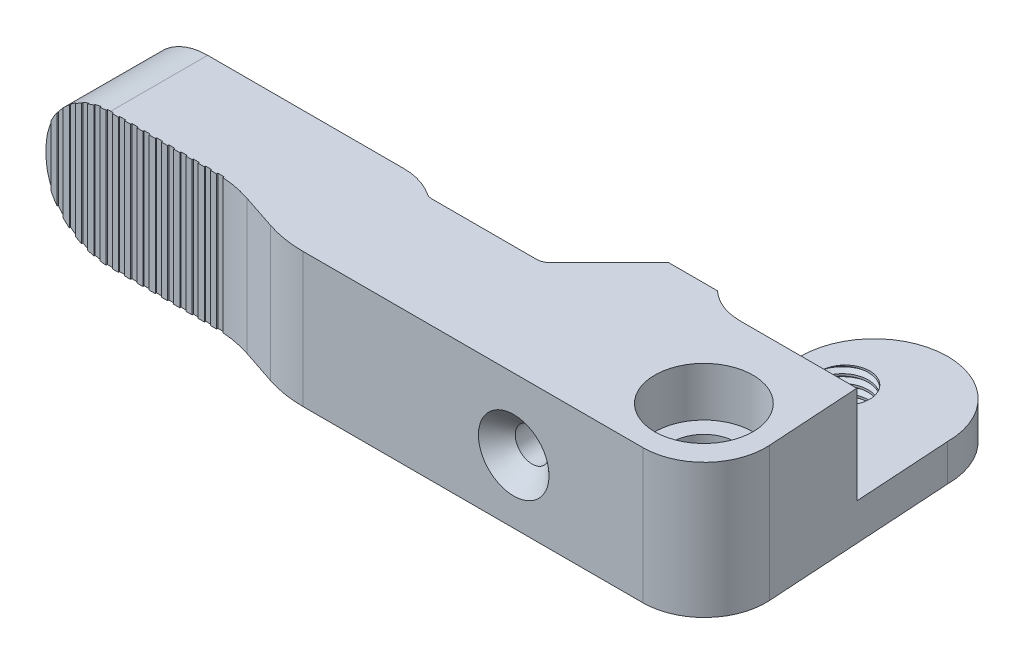
from build123d import *
from build123d.topology import SkipClean

# Parameters (mm, degrees)
BOSS_EXTRUDE1_DEPTH = 3
BOSS_EXTRUDE2_DEPTH = 7.95
FILLET1_R           = 5.27
FILLET2_R           = 5
SKETCH3_R           = 4
CUT_EXTRUDE1_DEPTH  = 4
CUT_EXTRUDE2_REACH  = 64.47
SKETCH4_R           = 2.575
CUT_EXTRUDE3_REACH  = 64.589
SKETCH5_R           = 2
SKETCH6_W           = 0.5
SKETCH6_H           = 10.95
CUT_EXTRUDE4_DEPTH  = 0.1
FILLET3_R           = 10
FILLET4_R           = 5
FILLET5_R           = 1
CUT_EXTRUDE5_REACH  = 60.777
SKETCH8_R           = 1.375
CHAMFER1_SIZE       = 0.1
CHAMFER2_SIZE       = 1.5
SKETCH9_R           = 1.5
CUT_EXTRUDE6_DEPTH  = 5
THREAD1_PITCH       = 0.5
THREAD2_PITCH       = 0.7


with BuildPart() as part:
    # Sketch1 → Boss-Extrude1 (new body)
    with BuildSketch(Plane(origin=(0, 0, 0), x_dir=(1, 0, 0), z_dir=(0, 1, 0))):
        with BuildLine():
            Line((0, 0), (-34.63, 0))
            Line((-34.63, 0), (-40.5, 1.95))
            Line((-40.5, 1.95), (-56, 1.95))
            Line((-56, 1.95), (-56, 9.95))
            Line((-56, 9.95), (-33.25, 9.95))
            Line((-33.25, 9.95), (-31.75, 8.95))
            Line((-31.75, 8.95), (-22.5, 8.95))
            Line((-22.5, 8.95), (-15.782485579, 15.667514421))
            ThreePointArc((-15.782485579, 15.667514421), (-14.107475652, 18.023952303), (-13.3, 20.8))
            ThreePointArc((-13.3, 20.8), (-7.3, 26.8), (-1.3, 20.8))
            Line((-1.3, 20.8), (0, 0))
        make_face()
    extrude(amount=BOSS_EXTRUDE1_DEPTH)

    # Sketch2 → Boss-Extrude2 (add)
    with BuildSketch(Plane(origin=(0, 3, 0), x_dir=(1, 0, 0), z_dir=(0, 1, 0))):
        with BuildLine():
            Line((-0.80625, 12.9), (-10.30625, 12.9))
            ThreePointArc((-10.30625, 12.9), (-11.942130043, 13.210830958), (-13.35, 14.1))
            Line((-13.35, 14.1), (-17.35, 14.1))
            Line((-17.35, 14.1), (-22.5, 8.95))
            Line((-22.5, 8.95), (-31.75, 8.95))
            Line((-31.75, 8.95), (-33.25, 9.95))
            Line((-33.25, 9.95), (-56, 9.95))
            Line((-56, 9.95), (-56, 1.95))
            Line((-56, 1.95), (-40.5, 1.95))
            Line((-40.5, 1.95), (-34.63, 0))
            Line((-34.63, 0), (0, 0))
            Line((0, 0), (-0.80625, 12.9))
        make_face()
    extrude(amount=BOSS_EXTRUDE2_DEPTH)

    # Fillet1
    fillet1_edges = [part.edges().sort_by_distance(p)[0] for p in [
        (-56, 0, -5.95),
        (-56, 10.95, -5.95),
    ]]
    fillet(fillet1_edges, radius=FILLET1_R)

    # Fillet2
    fillet2_edges = [part.edges().sort_by_distance(p)[0] for p in [
        (0, 5.475, 0),
    ]]
    fillet(fillet2_edges, radius=FILLET2_R)

    # Sketch3 → Cut-Extrude1 (cut)
    with BuildSketch(Plane(origin=(0, 10.95, 0), x_dir=(1, 0, 0), z_dir=(0, 1, 0))):
        with Locations(Location((-5.96092684, 5.6, 0), (0, 0, 270))):
            Circle(SKETCH3_R)
    extrude(amount=-CUT_EXTRUDE1_DEPTH, mode=Mode.SUBTRACT)

    # Sketch4 → Cut-Extrude2 (cut, up to next)
    with BuildSketch(Plane(origin=(0, 6.95, 0), x_dir=(1, 0, 0), z_dir=(0, 1, 0)), mode=Mode.PRIVATE) as cut_extrude2_sk1:
        with Locations(Location((-5.96092684, 5.6, 0), (0, 0, 270))):
            Circle(SKETCH4_R)
    cut_extrude2_tool1 = extrude(cut_extrude2_sk1.sketch, amount=-CUT_EXTRUDE2_REACH, mode=Mode.PRIVATE) & part.part
    add(cut_extrude2_tool1.solids().sort_by_distance((-5.960927, 6.95, -5.6))[0], mode=Mode.SUBTRACT)

    # Sketch5 → Cut-Extrude3 (cut, up to next)
    with BuildSketch(Plane(origin=(0, 3, 0), x_dir=(1, 0, 0), z_dir=(0, 1, 0)), mode=Mode.PRIVATE) as cut_extrude3_sk1:
        with Locations(Location((-9.453402454, 20.6, 0), (0, 0, 270))):
            Circle(SKETCH5_R)
    cut_extrude3_tool1 = extrude(cut_extrude3_sk1.sketch, amount=-CUT_EXTRUDE3_REACH, mode=Mode.PRIVATE) & part.part
    add(cut_extrude3_tool1.solids().sort_by_distance((-9.453402, 3, -20.6))[0], mode=Mode.SUBTRACT)

    # Sketch6 → Cut-Extrude4 (cut)
    with BuildSketch(Plane.XY.offset(-1.95)):
        with Locations((-41.75, 5.475)):
            Rectangle(SKETCH6_W, SKETCH6_H)
        with Locations((-42.75, 5.475)):
            Rectangle(SKETCH6_W, SKETCH6_H)
        with Locations((-43.75, 5.475)):
            Rectangle(SKETCH6_W, SKETCH6_H)
        with Locations((-44.75, 5.475)):
            Rectangle(SKETCH6_W, SKETCH6_H)
        with Locations((-45.75, 5.475)):
            Rectangle(SKETCH6_W, SKETCH6_H)
        with Locations((-46.75, 5.475)):
            Rectangle(SKETCH6_W, SKETCH6_H)
        with Locations((-47.75, 5.475)):
            Rectangle(SKETCH6_W, SKETCH6_H)
        with Locations((-48.75, 5.475)):
            Rectangle(SKETCH6_W, SKETCH6_H)
        with Locations((-49.75, 5.475)):
            Rectangle(SKETCH6_W, SKETCH6_H)
        with Locations((-50.75, 5.475)):
            Rectangle(SKETCH6_W, SKETCH6_H)
        with Locations((-51.75, 5.475)):
            Rectangle(SKETCH6_W, SKETCH6_H)
        with Locations((-52.75, 5.475)):
            Rectangle(SKETCH6_W, SKETCH6_H)
        with Locations((-53.75, 5.475)):
            Rectangle(SKETCH6_W, SKETCH6_H)
        with Locations((-54.75, 5.475)):
            Rectangle(SKETCH6_W, SKETCH6_H)
        with Locations((-55.75, 5.475)):
            Rectangle(SKETCH6_W, SKETCH6_H)
    extrude(amount=-CUT_EXTRUDE4_DEPTH, mode=Mode.SUBTRACT)

    # Fillet3
    # the kernel refuses this fillet: 10 mm, written as the material it adds along each edge
    with BuildSketch(Plane(origin=(-40.5, 10.95, -1.95), x_dir=(-1, 0, 0), z_dir=(0, -1, 0))) as fillet3_piece_1:
        with BuildLine():
            CenterArc((1.689083992, -9.976229912), FILLET3_R, 93.951291698, 14.425072504)
            Line((-1.463491782, -0.486168479), (0, 0))
            Line((0, 0), (1, 0))
        make_face()
    extrude(amount=10.95)
    # the kernel refuses this fillet: 10 mm, written as the material it takes off along each edge
    with BuildSketch(Plane(origin=(-34.63, 14.99382483, 0), x_dir=(-0.9490061432337238, 0, -0.3152575773945059), z_dir=(0, -1, 0))) as fillet3_2_piece_1:
        with BuildLine():
            CenterArc((FILLET3_R * 0.16175299318, FILLET3_R), FILLET3_R, 251.623635798, 18.376364202)
            Line((-FILLET3_R * 0.153504584214, FILLET3_R * 0.0509938567663), (0, 0))
            Line((0, 0), (FILLET3_R * 0.16175299318, 0))
        make_face()
    extrude(amount=19.037649659, mode=Mode.SUBTRACT)

    # Fillet4
    fillet4_edges = [part.edges().sort_by_distance(p)[0] for p in [
        (-33.25, 5.475, -9.95),
    ]]
    fillet(fillet4_edges, radius=FILLET4_R)

    # Fillet5
    fillet5_edges = [part.edges().sort_by_distance(p)[0] for p in [
        (-22.5, 5.475, -8.95),
        (-31.75, 5.475, -8.95),
    ]]
    fillet(fillet5_edges, radius=FILLET5_R)

    # Sketch8 → Cut-Extrude5 (cut, up to next)
    with BuildSketch(Plane(origin=(0, 0, -14.1), x_dir=(-1, 0, 0), z_dir=(0, 0, -1)), mode=Mode.PRIVATE) as cut_extrude5_sk1:
        with Locations((15.85, 5.15)):
            Circle(SKETCH8_R)
    cut_extrude5_tool1 = extrude(cut_extrude5_sk1.sketch, amount=-CUT_EXTRUDE5_REACH, mode=Mode.PRIVATE) & part.part
    add(cut_extrude5_tool1.solids().sort_by_distance((-15.85, 5.15, -14.1))[0], mode=Mode.SUBTRACT)

    # Chamfer1
    chamfer1_edges = [part.edges().sort_by_distance(p)[0] for p in [
        (-14.475, 5.15, -14.1),
    ]]
    chamfer(chamfer1_edges, length=CHAMFER1_SIZE)

    # Chamfer2
    chamfer2_edges = [part.edges().sort_by_distance(p)[0] for p in [
        (-14.475, 5.15, 0),
    ]]
    chamfer(chamfer2_edges, length=CHAMFER2_SIZE)

    # Sketch9 → Cut-Extrude6 (cut)
    with BuildSketch(Plane(origin=(0, 0, -9.95), x_dir=(-1, 0, 0), z_dir=(0, 0, -1))):
        with Locations((36.763878189, 5.494306727)):
            Circle(SKETCH9_R)
    extrude(amount=-CUT_EXTRUDE6_DEPTH, mode=Mode.SUBTRACT)

    # Thread1: arcs per turn and ends read off the stored shape
    # Thread1: the profile of Thread Profile2 profile screwed along a right-hand helix through 10 turns, 6 arcs to a turn; built about Z, then put on its axis
    with SkipClean():  # the faces are left unmerged after this step: merging them gives an invalid solid
        thread1_z = Axis((0, 0, 0), (0, 0, 1))
        thread1_corners = [(1.4997, 0, -0.000173205), (1.770632938, 0, 0.156249999), (1.770632938, 0, 0.218749999), (1.4997, 0, 0.375173204)]
        with BuildLine(mode=Mode.PRIVATE) as thread1_profile:
            Line(thread1_corners[0], thread1_corners[1])
            Line(thread1_corners[1], thread1_corners[2])
            Line(thread1_corners[2], thread1_corners[3])
            Line(thread1_corners[3], thread1_corners[0])
        thread1_cap = Face(thread1_profile.wire())
        thread1_turn_angles = [0, 30, 60, 90, 120, 150, 180, 210, 240, 270, 300, 330, 360]
        thread1_turn_weights = [1, 0.8660254037844387, 1, 0.8660254037844387, 1, 0.8660254037844387, 1, 0.8660254037844387, 1, 0.8660254037844387, 1, 0.8660254037844387, 1]
        thread1_turn_rails = [Edge.make_bspline([Vector(p[0], p[1], 0).rotate(thread1_z, thread1_turn_angles[k]) / thread1_turn_weights[k] + Vector(0, 0, p[2] + THREAD1_PITCH * thread1_turn_angles[k] / 360) for k in range(13)], [0, 0, 0, 1, 1, 2, 2, 3, 3, 4, 4, 5, 5, 6, 6, 6], 2, thread1_turn_weights) for p in thread1_corners]
        thread1_turn_sides = [Face.make_surface_from_curves(thread1_turn_rails[p[0]], thread1_turn_rails[p[1]]) for p in [(0, 1), (1, 2), (2, 3), (3, 0)]]
        thread1 = Plane(origin=(-36.763878189, 5.494306727, -9.95), x_dir=(1, 0, 0), z_dir=(0, 0, 1)) * Solid(Shell([*[p.moved(Location((0, 0, THREAD1_PITCH * i))) for i in range(10) for p in thread1_turn_sides], thread1_cap, thread1_cap.rotate(thread1_z, 3600).moved(Location((0, 0, THREAD1_PITCH * 3600 / 360)))]))
        add(thread1, mode=Mode.SUBTRACT)

    # Thread2: arcs per turn and ends read off the stored shape
    # Thread2: the profile of Thread Profile3 profile screwed along a right-hand helix through 4.285714 turns, 6 arcs to a turn; built about Z, then put on its axis
    with SkipClean():  # the faces are left unmerged after this step: merging them gives an invalid solid
        thread2_z = Axis((0, 0, 0), (0, 0, 1))
        thread2_corners = [(1.9997, 0, -0.000173205), (2.378886113, 0, 0.218749999), (2.378886113, 0, 0.306249999), (1.9997, 0, 0.525173203)]
        with BuildLine(mode=Mode.PRIVATE) as thread2_profile:
            Line(thread2_corners[0], thread2_corners[1])
            Line(thread2_corners[1], thread2_corners[2])
            Line(thread2_corners[2], thread2_corners[3])
            Line(thread2_corners[3], thread2_corners[0])
        thread2_cap = Face(thread2_profile.wire())
        thread2_turn_angles = [0, 30, 60, 90, 120, 150, 180, 210, 240, 270, 300, 330, 360]
        thread2_turn_weights = [1, 0.8660254037844387, 1, 0.8660254037844387, 1, 0.8660254037844387, 1, 0.8660254037844387, 1, 0.8660254037844387, 1, 0.8660254037844387, 1]
        thread2_turn_rails = [Edge.make_bspline([Vector(p[0], p[1], 0).rotate(thread2_z, thread2_turn_angles[k]) / thread2_turn_weights[k] + Vector(0, 0, p[2] + THREAD2_PITCH * thread2_turn_angles[k] / 360) for k in range(13)], [0, 0, 0, 1, 1, 2, 2, 3, 3, 4, 4, 5, 5, 6, 6, 6], 2, thread2_turn_weights) for p in thread2_corners]
        thread2_turn_sides = [Face.make_surface_from_curves(thread2_turn_rails[p[0]], thread2_turn_rails[p[1]]) for p in [(0, 1), (1, 2), (2, 3), (3, 0)]]
        thread2_last_angles = [1440, 1470, 1500, 1521.428571429, 1542.857142857]
        thread2_last_weights = [1, 0.8660254037844387, 1, 0.9308737486442041, 1]
        thread2_last_rails = [Edge.make_bspline([Vector(p[0], p[1], 0).rotate(thread2_z, thread2_last_angles[k]) / thread2_last_weights[k] + Vector(0, 0, p[2] + THREAD2_PITCH * thread2_last_angles[k] / 360) for k in range(5)], [0, 0, 0, 1, 1, 2, 2, 2], 2, thread2_last_weights) for p in thread2_corners]
        thread2_last_sides = [Face.make_surface_from_curves(thread2_last_rails[p[0]], thread2_last_rails[p[1]]) for p in [(0, 1), (1, 2), (2, 3), (3, 0)]]
        thread2 = Plane(origin=(-9.453402454, 3, -20.6), x_dir=(-1, 0, 0), z_dir=(0, -1, 0)) * Solid(Shell([*[p.moved(Location((0, 0, THREAD2_PITCH * i))) for i in range(4) for p in thread2_turn_sides], *thread2_last_sides, thread2_cap, thread2_cap.rotate(thread2_z, 1542.857142857).moved(Location((0, 0, THREAD2_PITCH * 1542.857142857 / 360)))]))
        add(thread2, mode=Mode.SUBTRACT)


solid = part.part
